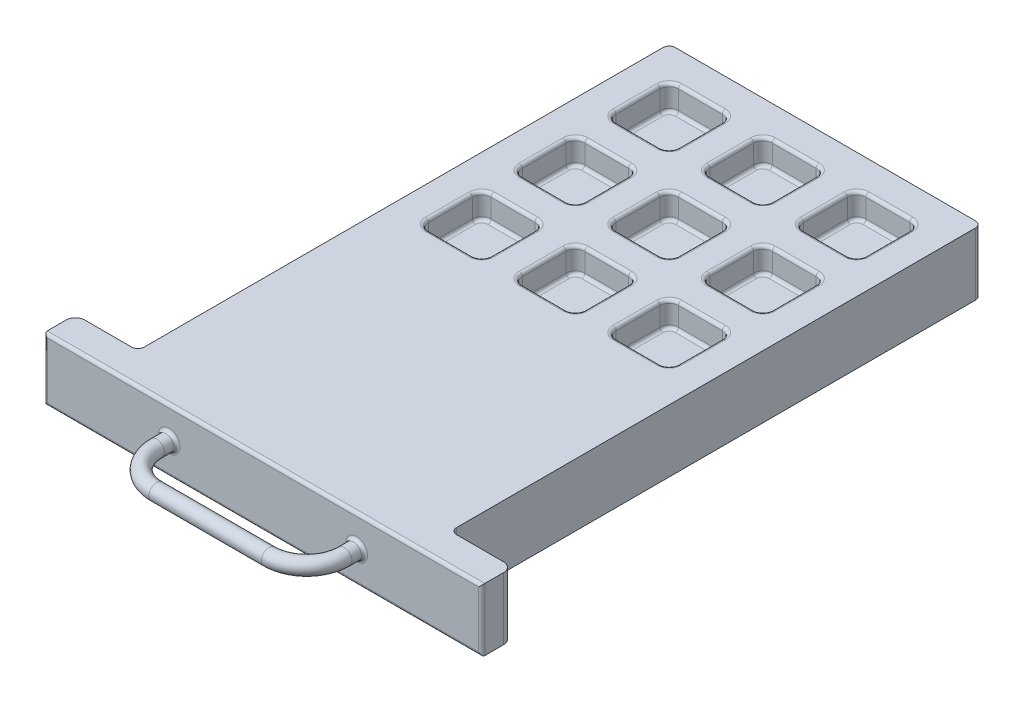
from build123d import *

# Parameters (mm, degrees)
EXTRUDE_1_DEPTH             = 20
CUT_EXTRUDE_3_DEPTH         = 8
PATTERN_LINEAR_3_COUNT      = 3
PATTERN_LINEAR_3_PITCH      = 30
PATTERN_LINEAR_3_COUNT_DIR2 = 3
PATTERN_LINEAR_3_PITCH_DIR2 = 30
SKETCH_5_R                  = 2.5
FILLET4_R                   = 1
FILLET5_R                   = 1
FILLET6_R                   = 1


with BuildPart() as part:
    # 草图1 → 凸台-拉伸1 (new body)
    with BuildSketch(Plane(origin=(0, 0, 0), x_dir=(1, 0, 0), z_dir=(0, 1, 0))):
        with BuildLine():
            Line((-48, 180), (48, 180))
            ThreePointArc((48, 180), (49.414213562, 179.414213562), (50, 178))
            Line((50, 178), (50, 12))
            ThreePointArc((50, 12), (50.585786438, 10.585786438), (52, 10))
            Line((52, 10), (67, 10))
            ThreePointArc((67, 10), (69.121320344, 9.121320344), (70, 7))
            Line((70, 7), (70, 0))
            Line((70, 0), (-70, 0))
            Line((-70, 0), (-70, 7))
            ThreePointArc((-70, 7), (-69.121320344, 9.121320344), (-67, 10))
            Line((-67, 10), (-52, 10))
            ThreePointArc((-52, 10), (-50.585786438, 10.585786438), (-50, 12))
            Line((-50, 12), (-50, 178))
            ThreePointArc((-50, 178), (-49.414213562, 179.414213562), (-48, 180))
        make_face()
    extrude(amount=EXTRUDE_1_DEPTH)

    # 草图3 → 切除-拉伸3 (cut)
    with BuildSketch(Plane(origin=(0, 20, 0), x_dir=(1, 0, 0), z_dir=(0, 1, 0))):
        with BuildLine():
            Line((-37, 170), (-23, 170))
            ThreePointArc((-23, 170), (-20.878679656, 169.121320344), (-20, 167))
            Line((-20, 167), (-20, 153))
            ThreePointArc((-20, 153), (-20.878679656, 150.878679656), (-23, 150))
            Line((-23, 150), (-37, 150))
            ThreePointArc((-37, 150), (-39.121320344, 150.878679656), (-40, 153))
            Line((-40, 153), (-40, 167))
            ThreePointArc((-40, 167), (-39.121320344, 169.121320344), (-37, 170))
        make_face()
    cut_extrude_3 = extrude(amount=-CUT_EXTRUDE_3_DEPTH, mode=Mode.SUBTRACT)

    # 阵列(线性)3: Cut-Extrude 3 3 × 3
    with Locations(*[(i * PATTERN_LINEAR_3_PITCH, 0, j * PATTERN_LINEAR_3_PITCH_DIR2) for i in range(PATTERN_LINEAR_3_COUNT) for j in range(PATTERN_LINEAR_3_COUNT_DIR2) if (i, j) != (0, 0)]):
        add(cut_extrude_3, mode=Mode.SUBTRACT)

    # 扫描1: sweep along a path in 草图4
    with BuildLine(Plane(origin=(0, 10, 0), x_dir=(-1, 0, 0), z_dir=(0, -1, 0))) as sweep_1_path:
        Line((-30, 0), (-30, -4))
        ThreePointArc((-30, -4), (-26.485281374, -12.485281374), (-18, -16))
        Line((-18, -16), (18, -16))
        ThreePointArc((18, -16), (26.485281374, -12.485281374), (30, -4))
        Line((30, -4), (30, 0))
    # 草图5 → 扫描1 (sweep)
    with BuildSketch(Plane.XY):
        with Locations((-30, 10)):
            Circle(SKETCH_5_R)
    sweep(path=sweep_1_path.line)

    # Fillet4
    fillet4_edges = [part.edges().sort_by_distance(p)[0] for p in [
        (32.5, 10, 0),
        (-32.5, 10, 0),
        (-70, 10, 0),
        (0, 20, 0),
        (70, 10, 0),
        (0, 0, 0),
    ]]
    fillet(fillet4_edges, radius=FILLET4_R)

    # Fillet5
    fillet5_edges = [part.edges().sort_by_distance(p)[0] for p in [
        (-20, 12, -100),
        (-20, 20, -100),
        (-30, 12, -110),
        (-30, 20, -110),
        (-39.121320344, 12, -109.121320344),
        (-39.121320344, 20, -109.121320344),
        (-30, 12, -90),
        (-30, 20, -90),
        (-39.121320344, 12, -90.878679656),
        (-39.121320344, 20, -90.878679656),
        (-20.878679656, 12, -90.878679656),
        (-20.878679656, 20, -90.878679656),
        (-20.878679656, 12, -109.121320344),
        (-20.878679656, 20, -109.121320344),
        (-40, 12, -100),
        (-40, 20, -100),
    ]]
    fillet(fillet5_edges, radius=FILLET5_R)

    # Fillet6
    fillet6_edges = [part.edges().sort_by_distance(p)[0] for p in [
        (30, 12, -110),
        (39.121320344, 12, -109.121320344),
        (40, 12, -100),
        (39.121320344, 12, -90.878679656),
        (30, 12, -90),
        (20.878679656, 12, -90.878679656),
        (20, 12, -100),
        (30, 20, -110),
        (39.121320344, 20, -109.121320344),
        (40, 20, -100),
        (39.121320344, 20, -90.878679656),
        (30, 20, -90),
        (20.878679656, 20, -90.878679656),
        (20, 20, -100),
        (30, 12, -140),
        (39.121320344, 12, -139.121320344),
        (40, 12, -130),
        (39.121320344, 12, -120.878679656),
        (30, 12, -120),
        (20.878679656, 12, -120.878679656),
        (20, 12, -130),
        (30, 20, -140),
        (39.121320344, 20, -139.121320344),
        (40, 20, -130),
        (39.121320344, 20, -120.878679656),
        (30, 20, -120),
        (20.878679656, 20, -120.878679656),
        (20, 20, -130),
        (30, 12, -170),
        (39.121320344, 12, -169.121320344),
        (40, 12, -160),
        (39.121320344, 12, -150.878679656),
        (30, 12, -150),
        (20.878679656, 12, -150.878679656),
        (20, 12, -160),
        (30, 20, -170),
        (39.121320344, 20, -169.121320344),
        (40, 20, -160),
        (39.121320344, 20, -150.878679656),
        (30, 20, -150),
        (20.878679656, 20, -150.878679656),
        (20, 20, -160),
        (0, 12, -170),
        (9.121320344, 12, -169.121320344),
        (10, 12, -160),
        (9.121320344, 12, -150.878679656),
        (0, 12, -150),
        (-9.121320344, 12, -150.878679656),
        (-10, 12, -160),
        (0, 20, -170),
        (9.121320344, 20, -169.121320344),
        (10, 20, -160),
        (9.121320344, 20, -150.878679656),
        (0, 20, -150),
        (-9.121320344, 20, -150.878679656),
        (-10, 20, -160),
        (-30, 12, -170),
        (-20.878679656, 12, -169.121320344),
        (-20, 12, -160),
        (-20.878679656, 12, -150.878679656),
        (-30, 12, -150),
        (-39.121320344, 12, -150.878679656),
        (-40, 12, -160),
        (-30, 20, -170),
        (-20.878679656, 20, -169.121320344),
        (-20, 20, -160),
        (-20.878679656, 20, -150.878679656),
        (-30, 20, -150),
        (-39.121320344, 20, -150.878679656),
        (-40, 20, -160),
        (0, 12, -140),
        (9.121320344, 12, -139.121320344),
        (10, 12, -130),
        (9.121320344, 12, -120.878679656),
        (0, 12, -120),
        (-9.121320344, 12, -120.878679656),
        (-10, 12, -130),
        (0, 20, -140),
        (9.121320344, 20, -139.121320344),
        (10, 20, -130),
        (9.121320344, 20, -120.878679656),
        (0, 20, -120),
        (-9.121320344, 20, -120.878679656),
        (-10, 20, -130),
        (0, 12, -110),
        (9.121320344, 12, -109.121320344),
        (10, 12, -100),
        (9.121320344, 12, -90.878679656),
        (0, 12, -90),
        (-9.121320344, 12, -90.878679656),
        (-10, 12, -100),
        (0, 20, -110),
        (9.121320344, 20, -109.121320344),
        (10, 20, -100),
        (9.121320344, 20, -90.878679656),
        (0, 20, -90),
        (-9.121320344, 20, -90.878679656),
        (-10, 20, -100),
        (-30, 12, -140),
        (-20.878679656, 12, -139.121320344),
        (-20, 12, -130),
        (-20.878679656, 12, -120.878679656),
        (-30, 12, -120),
        (-39.121320344, 12, -120.878679656),
        (-40, 12, -130),
        (-30, 20, -140),
        (-20.878679656, 20, -139.121320344),
        (-20, 20, -130),
        (-20.878679656, 20, -120.878679656),
        (-30, 20, -120),
        (-39.121320344, 20, -120.878679656),
        (-40, 20, -130),
        (20.878679656, 12, -109.121320344),
        (20.878679656, 20, -109.121320344),
        (20.878679656, 12, -139.121320344),
        (20.878679656, 20, -139.121320344),
        (20.878679656, 12, -169.121320344),
        (20.878679656, 20, -169.121320344),
        (-9.121320344, 12, -169.121320344),
        (-9.121320344, 20, -169.121320344),
        (-39.121320344, 12, -169.121320344),
        (-39.121320344, 20, -169.121320344),
        (-9.121320344, 12, -139.121320344),
        (-9.121320344, 20, -139.121320344),
        (-9.121320344, 12, -109.121320344),
        (-9.121320344, 20, -109.121320344),
        (-39.121320344, 12, -139.121320344),
        (-39.121320344, 20, -139.121320344),
    ]]
    fillet(fillet6_edges, radius=FILLET6_R)


solid = part.part
